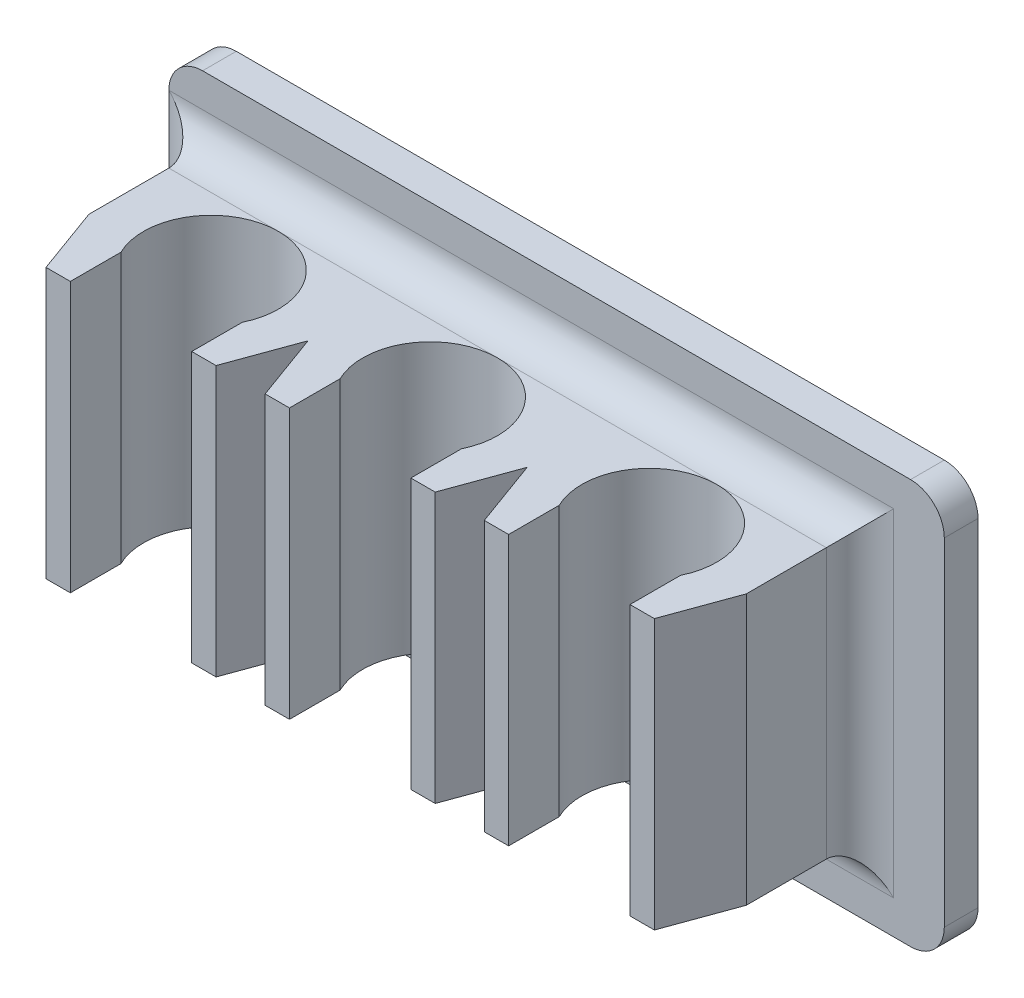
from build123d import *

# Parameters (mm, degrees)
SKETCH1_W           = 23
SKETCH1_H           = 12
BOSS_EXTRUDE1_DEPTH = 1
BOSS_EXTRUDE2_DEPTH = 4
LPATTERN2_COUNT     = 3
LPATTERN2_PITCH     = 6.5
FILLET1_R           = 1
FILLET2_R           = 1


with BuildPart() as part:
    # Sketch1 → Boss-Extrude1 (new body)
    with BuildSketch(Plane.XY):
        Rectangle(SKETCH1_W, SKETCH1_H)
    extrude(amount=BOSS_EXTRUDE1_DEPTH)

    # Sketch3 → Boss-Extrude2 (add, symmetric)
    with BuildSketch(Plane.XZ):
        with BuildLine():
            Line((-10.5, 1), (-10.5, 4.371779789))
            Line((-10.5, 4.371779789), (-9.772059531, 6.371779789))
            Line((-9.772059531, 6.371779789), (-9.05, 6.371779789))
            Line((-9.05, 6.371779789), (-9.05, 4.871779789))
            ThreePointArc((-9.05, 4.871779789), (-7.25, 2), (-5.45, 4.871779789))
            Line((-5.45, 4.871779789), (-5.45, 6.371779789))
            Line((-5.45, 6.371779789), (-4.727940469, 6.371779789))
            Line((-4.727940469, 6.371779789), (-4, 4.371779789))
            Line((-4, 4.371779789), (-4, 1))
            Line((-4, 1), (-10.5, 1))
        make_face()
    boss_extrude2 = extrude(amount=BOSS_EXTRUDE2_DEPTH, both=True)

    # LPattern2: Boss-Extrude2 ×3
    with Locations(*[(i * LPATTERN2_PITCH, 0, 0) for i in range(1, LPATTERN2_COUNT)]):
        add(boss_extrude2)

    # Fillet1
    fillet1_edges = [part.edges().sort_by_distance(p)[0] for p in [
        (-11.5, 6, 0.5),
        (11.5, 6, 0.5),
        (11.5, -6, 0.5),
        (-11.5, -6, 0.5),
    ]]
    fillet(fillet1_edges, radius=FILLET1_R)

    # Fillet2
    fillet2_edges = [part.edges().sort_by_distance(p)[0] for p in [
        (-0.75, 4, 1),
        (-10.5, 0, 1),
        (-0.75, -4, 1),
        (9, 0, 1),
    ]]
    fillet(fillet2_edges, radius=FILLET2_R - 0.0001)  # a hair under: the kernel refuses the full size


solid = part.part
